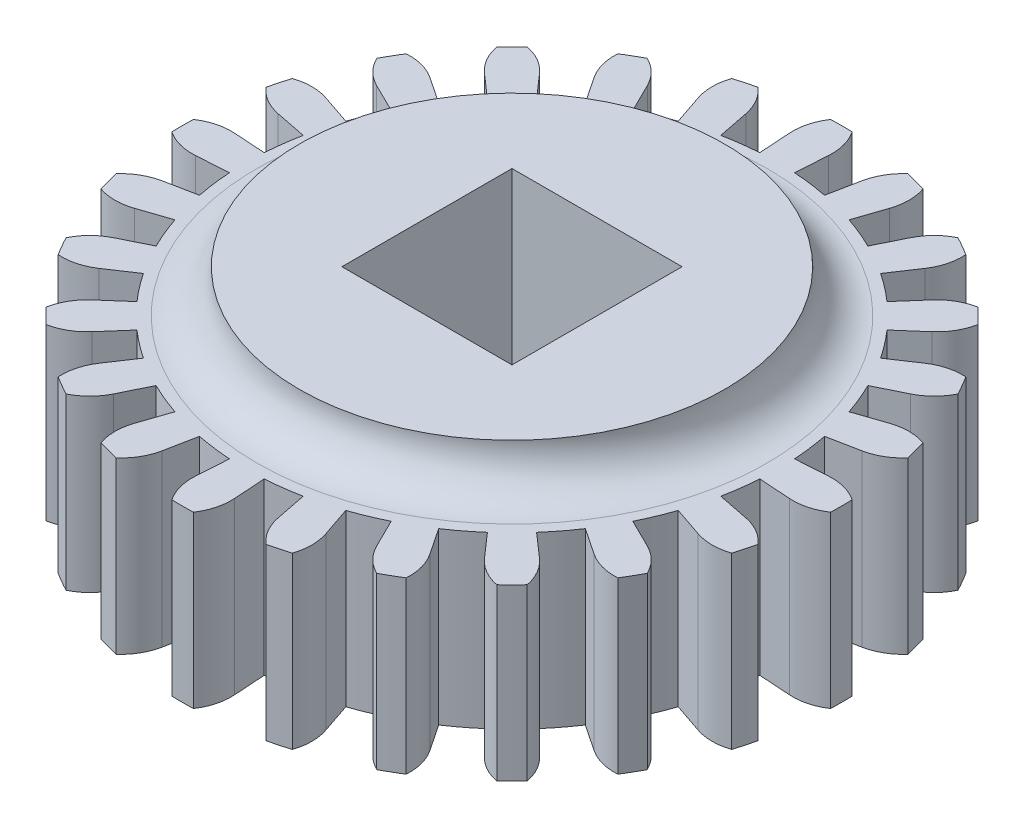
from build123d import *

# Parameters (mm, degrees)
BOSS_EXTRUDE3_DEPTH = 8
CIRPATTERN1_COUNT   = 24
SKETCH12_W          = 8
SKETCH12_H          = 8
CUT_EXTRUDE1_DEPTH  = 24.334523779
SKETCH13_R          = 10
SKETCH13_W          = 8
SKETCH13_H          = 8
BOSS_EXTRUDE4_DEPTH = 2
FILLET1_R           = 2


with BuildPart() as part:
    # Sketch10 → Boss-Extrude3 (new body)
    with BuildSketch(Plane(origin=(0, 0, 0), x_dir=(1, 0, 0), z_dir=(0, 1, 0))):
        with BuildLine():
            ThreePointArc((15.491701106, 0.507145784), (15.5, 0), (15.491701106, -0.507145784))
            ThreePointArc((15.491701106, -0.507145784), (14.76463394, -0.837193229), (13.970024925, -0.915643809))
            Line((13.970024925, -0.915643809), (12.47323654, -0.817539115))
            ThreePointArc((12.47323654, -0.817539115), (12.439809083, -1.225214254), (12.393060767, -1.631577403))
            Line((12.393060767, -1.631577403), (0, 0))
            Line((0, 0), (12.393060767, 1.631577403))
            ThreePointArc((12.393060767, 1.631577403), (12.439809083, 1.225214254), (12.47323654, 0.817539115))
            Line((12.47323654, 0.817539115), (13.970024925, 0.915643809))
            ThreePointArc((13.970024925, 0.915643809), (14.76463394, 0.837193229), (15.491701106, 0.507145784))
        make_face()
    boss_extrude3 = extrude(amount=BOSS_EXTRUDE3_DEPTH)

    # CirPattern1: Boss-Extrude3 ×24 about axis
    cirpattern1_axis = Axis((0, 0, 0), (0, 1, 0))
    for i in range(1, CIRPATTERN1_COUNT):
        add(boss_extrude3.rotate(cirpattern1_axis, i * 360 / CIRPATTERN1_COUNT))

    # Sketch12 → Cut-Extrude1 (cut, through all)
    with BuildSketch(Plane.XZ):
        Rectangle(SKETCH12_W, SKETCH12_H)
    extrude(amount=-CUT_EXTRUDE1_DEPTH, mode=Mode.SUBTRACT)

    # Sketch13 → Boss-Extrude4 (add)
    with BuildSketch(Plane(origin=(0, 8, 0), x_dir=(1, 0, 0), z_dir=(0, 1, 0))):
        with Locations(Location((0, 0, 0), (0, 0, 270))):
            Circle(SKETCH13_R)
        Rectangle(SKETCH13_W, SKETCH13_H, mode=Mode.SUBTRACT)
    extrude(amount=BOSS_EXTRUDE4_DEPTH)

    # Fillet1
    fillet1_edges = [part.edges().sort_by_distance(p)[0] for p in [
        (0, 8, -10),
    ]]
    fillet(fillet1_edges, radius=FILLET1_R - 0.0001)  # a hair under: the kernel refuses the full size


solid = part.part
